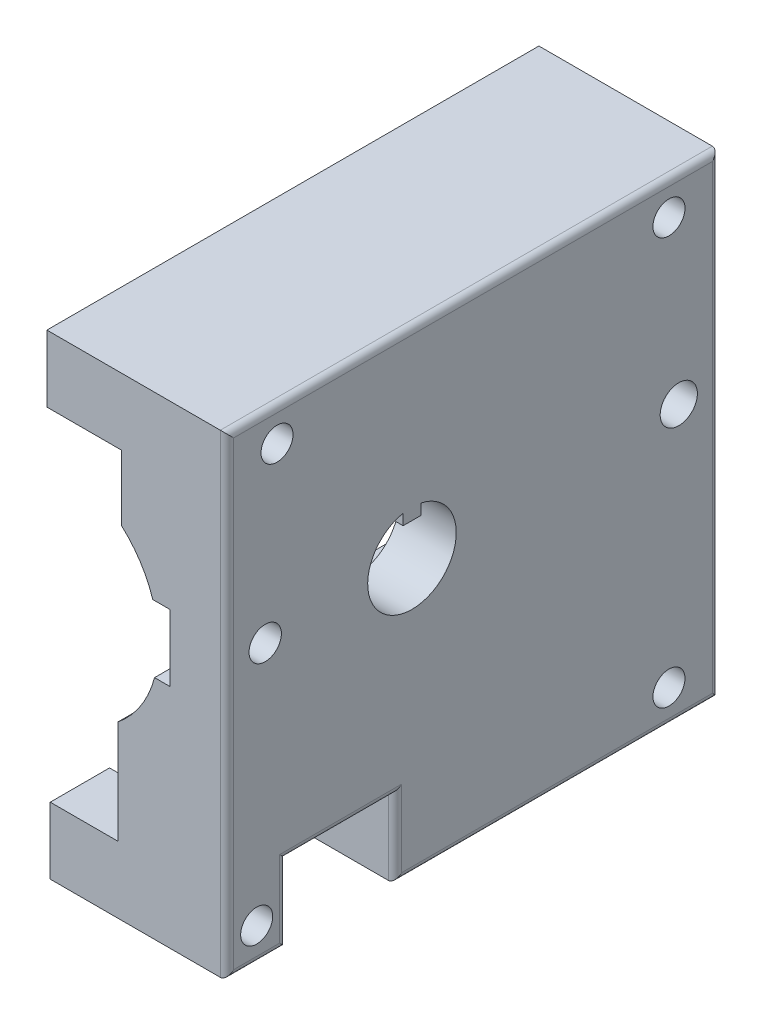
from build123d import *

# Parameters (mm, degrees)
PROFILEEXTRUDE_DEPTH = 73.76
HOSEWINDOW_W         = 16.29
HOSEWINDOW_H         = 11.5
HOSEWINDOWCUT_DEPTH  = 90.849500732
CAGESCREWS_R         = 2.4
CAGESCREWSCUT_DEPTH  = 90.849500732
AXLEHOLECUT_DEPTH    = 90.849500732
SETSCREWS_R          = 2.426338021
SETSCREWS_R_2        = 2.788762315
SETSCREWSCUT_DEPTH   = 90.849500814
FILLET1_R            = 1


with BuildPart() as part:
    # Profile → ProfileExtrude (new body)
    with BuildSketch(Plane.XY):
        with BuildLine():
            Line((-6.01073477, -43.62791746), (-6.01073477, -33.62791746))
            Line((-6.01073477, -33.62791746), (4.13926523, -33.62791746))
            Line((4.13926523, -33.62791746), (4.13926523, -18.13791746))
            ThreePointArc((4.13926523, -18.13791746), (7.563334043, -14.326029686), (9.63126523, -9.63791746))
            Line((9.63126523, -9.63791746), (11.94926523, -9.63791746))
            Line((11.94926523, -9.63791746), (11.94926523, 0.36208254))
            Line((11.94926523, 0.36208254), (9.35926523, 0.36208254))
            ThreePointArc((9.35926523, 0.36208254), (7.493178347, 4.320032013), (4.63926523, 7.63708254))
            Line((4.63926523, 7.63708254), (4.63926523, 17.41208254))
            Line((4.63926523, 17.41208254), (-6.51073477, 17.41208254))
            Line((-6.51073477, 17.41208254), (-6.51073477, 27.41208254))
            Line((-6.51073477, 27.41208254), (20.48926523, 27.41208254))
            Line((20.48926523, 27.41208254), (20.48926523, -43.62791746))
            Line((20.48926523, -43.62791746), (-6.01073477, -43.62791746))
        make_face()
    extrude(amount=PROFILEEXTRUDE_DEPTH)

    # HoseWindow → HoseWindowCut (cut, through all)
    with BuildSketch(Plane(origin=(20.48926523, 0, 0), x_dir=(0, 0, -1), z_dir=(1, 0, 0))):
        with Locations((-56.725, -37.87791746)):
            Rectangle(HOSEWINDOW_W, HOSEWINDOW_H)
    extrude(amount=-HOSEWINDOWCUT_DEPTH, mode=Mode.SUBTRACT)

    # CageScrews → CageScrewsCut (cut, through all)
    with BuildSketch(Plane(origin=(20.48926523, 0, 0), x_dir=(0, 0, -1), z_dir=(1, 0, 0))):
        with Locations((-66.26, 22.41208254)):
            Circle(CAGESCREWS_R)
        with Locations((-7.5, 22.41208254)):
            Circle(CAGESCREWS_R)
        with Locations((-7.5, -38.62791746)):
            Circle(CAGESCREWS_R)
        with Locations((-69.31, -38.62791746)):
            Circle(CAGESCREWS_R)
    extrude(amount=-CAGESCREWSCUT_DEPTH, mode=Mode.SUBTRACT)

    # AxleHole → AxleHoleCut (cut, through all)
    with BuildSketch(Plane(origin=(20.48926523, 0, 0), x_dir=(0, 0, -1), z_dir=(1, 0, 0))):
        with BuildLine():
            Line((-44.699, 2.307293484), (-47.361, 2.307293484))
            Line((-47.361, 2.307293484), (-47.361, 3.926293484))
            ThreePointArc((-47.361, 3.926293484), (-46.03, -9.21691746), (-44.699, 3.926293484))
            Line((-44.699, 3.926293484), (-44.699, 2.307293484))
        make_face()
    extrude(amount=-AXLEHOLECUT_DEPTH, mode=Mode.SUBTRACT)

    # SetScrews → SetScrewsCut (cut, through all)
    with BuildSketch(Plane(origin=(20.48926523, 0, 0), x_dir=(0, 0, -1), z_dir=(1, 0, 0))):
        with Locations((-68.03, -2.57791746)):
            Circle(SETSCREWS_R)
        with Locations((-6.03, -2.57791746)):
            Circle(SETSCREWS_R_2)
    extrude(amount=-SETSCREWSCUT_DEPTH, mode=Mode.SUBTRACT)

    # Fillet1
    fillet1_edges = [part.edges().sort_by_distance(p)[0] for p in [
        (20.48926523, -37.87791746, 64.87),
        (20.48926523, -37.87791746, 48.58),
        (20.48926523, -32.12791746, 56.725),
        (20.48926523, -43.62791746, 69.315),
        (20.48926523, -8.10791746, 73.76),
        (20.48926523, -43.62791746, 24.29),
        (20.48926523, -8.10791746, 0),
        (20.48926523, 27.41208254, 36.88),
    ]]
    fillet(fillet1_edges, radius=FILLET1_R)


solid = part.part
